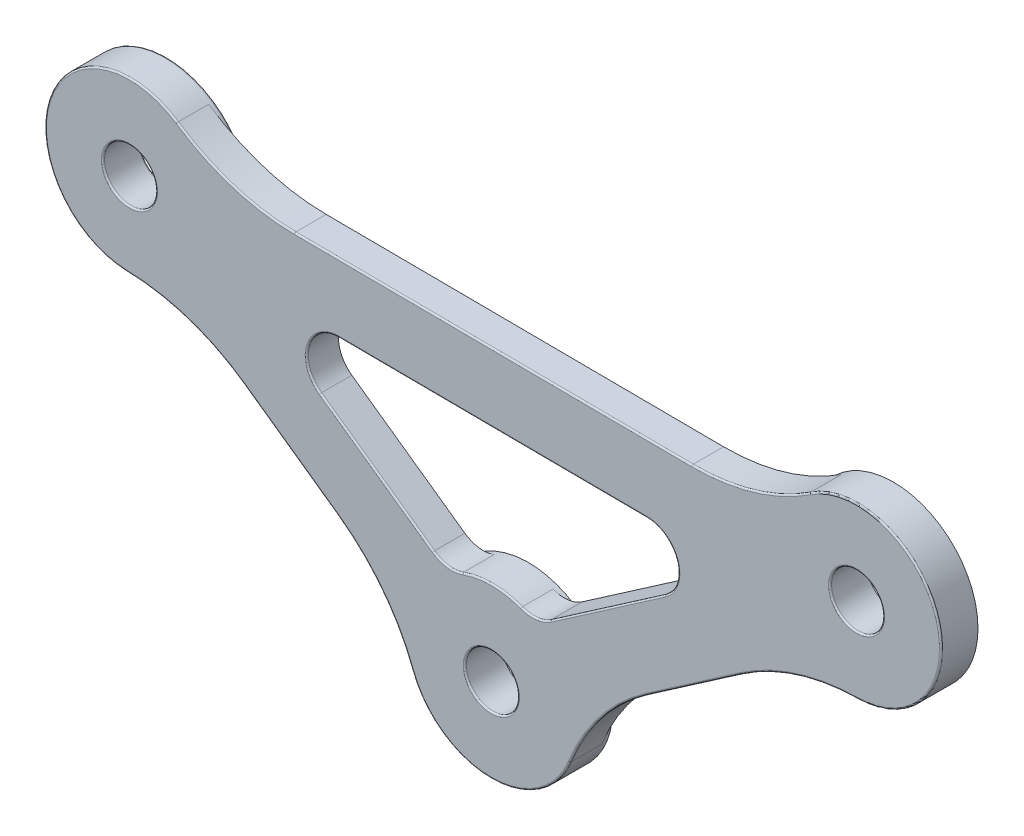
from build123d import *

# Parameters (mm, degrees)
SKETCH_1_R        = 8
SKETCH_1_R_2      = 2.5
EXTRUDE_1_DEPTH   = 3.5
EXTRUDE_1_2_DEPTH = 3.5
EXTRUDE_1_3_DEPTH = 3.5
EXTRUDE_1_4_DEPTH = 3
FILLET_1_R        = 3
FILLET_2_R        = 20
FILLET_3_R        = 0.15


with BuildPart() as part:
    # 草图1 → Extrude 1 (new body)
    with BuildSketch(Plane.XY):
        with Locations((-101.472478495, 222.230200701)):
            Circle(SKETCH_1_R)
        with Locations((-101.472478495, 222.230200701)):
            Circle(SKETCH_1_R_2, mode=Mode.SUBTRACT)
    extrude(amount=-EXTRUDE_1_DEPTH)



with BuildPart() as body_2:
    # 草图1 → Extrude 1 2 (new body)
    with BuildSketch(Plane.XY):
        with Locations((-32.665157049, 221.783455762)):
            Circle(SKETCH_1_R)
        with Locations((-32.665157049, 221.783455762)):
            Circle(SKETCH_1_R_2, mode=Mode.SUBTRACT)
    extrude(amount=-EXTRUDE_1_2_DEPTH)


with BuildPart() as body_3:
    # 草图1 → Extrude 1 3 (new body)
    with BuildSketch(Plane.XY):
        with Locations((-67.225224859, 197.917125651)):
            Circle(SKETCH_1_R)
        with Locations((-67.225224859, 197.917125651)):
            Circle(SKETCH_1_R_2, mode=Mode.SUBTRACT)
    extrude(amount=-EXTRUDE_1_3_DEPTH)


with BuildPart() as part_1:
    add(part.part)

    add(body_2.part)  # Extrude 1 4 merges body 2

    add(body_3.part)  # Extrude 1 4 merges body 3
    # 草图2 → Extrude 1 4 (add)
    with BuildSketch(Plane.XY):
        Polygon((-94.589918585, 218.935445838), (-39.589918585, 218.578347624), (-39.547716959, 225.078210624), (-94.547716959, 225.435308839), align=None)
        Polygon((-39.449108947, 221.048270993), (-64.134871668, 204.000892343), (-60.441272961, 198.65231042), (-35.755510239, 215.69968907), align=None)
        Polygon((-98.461382592, 216.106819162), (-73.999058567, 198.740336984), (-70.236320761, 204.040507189), (-94.698644787, 221.406989368), align=None)
    extrude(amount=-EXTRUDE_1_4_DEPTH)

    # 圆角1
    fillet_1_edges = [part_1.edges().sort_by_distance(p)[0] for p in [
        (-42.993723716, 218.600447492, -1.5),
        (-63.0568479, 204.745348958, -1.5),
        (-71.304586993, 204.798899011, -1.5),
        (-91.186113454, 218.91334597, -1.5),
    ]]
    fillet(fillet_1_edges, radius=FILLET_1_R)

    # 圆角2
    # the kernel refuses this fillet: 20 mm, written as the material it adds along each edge
    with BuildSketch(Plane(origin=(-94.141435997, 225.43267098, -3), x_dir=(-0.638505436471582, 0.7696173124327664, 0), z_dir=(0, 0, 1)), Plane(origin=(-36.833534007, 214.955232455, -3), x_dir=(0.9644673889945874, -0.26420192195736086, 0), z_dir=(0, 0, 1))) as fillet_2_piece_1:
        with BuildLine():
            CenterArc((9.973052641, -19.217229771), FILLET_2_R, 106.082980193, 33.864557297)
            Line((-5.336058514, -6.347454495), (0, 0))
            ThreePointArc((0, 0), (2.21623392, -0.313108092), (4.43246784, 0))
        make_face()
    extrude(amount=3)
    with BuildSketch(Plane(origin=(-39.95399792, 225.080848483, -3), x_dir=(-0.9999789231234605, 0.00649255795851874, 0), z_dir=(0, 0, 1)), Plane(origin=(-59.363249193, 199.396767035, -3), x_dir=(0.8228587573791318, 0.5682459550269326, 0), z_dir=(0, 0, 1)), Plane(origin=(-97.393116361, 215.348427341, -3), x_dir=(0.8154108008658386, -0.5788827392756946, 0), z_dir=(0, 0, 1))) as fillet_2_piece_2:
        with BuildLine():
            CenterArc((8.292388018, -20), FILLET_2_R, 90, 33.864557297)
            ThreePointArc((-2.852243251, -3.392857143), (-1.186451297, -1.89791011), (0, 0))
            Line((0, 0), (8.292388018, 0))
        make_face()
    extrude(amount=3)
    with BuildSketch(Plane(origin=(-75.067324798, 199.498728805, -3), x_dir=(-0.8154108008658375, 0.578882739275696, 0), z_dir=(0, 0, 1))) as fillet_2_piece_3:
        with BuildLine():
            CenterArc((8.292388018, 20), FILLET_2_R, 236.135442703, 33.864557297)
            ThreePointArc((-2.852243251, 3.392857143), (-1.186451297, 1.89791011), (0, 0))
            Line((0, 0), (8.292388018, 0))
        make_face()
    extrude(amount=3)

    # 圆角3
    fillet_3_edges = [part_1.edges().sort_by_distance(p)[0] for p in [
        (-67.089918585, 218.756896731, 0),
        (-78.076277889, 209.60631016, 0),
        (-56.223304427, 209.464425473, 0),
        (-67.173284395, 205.916957036, 0),
        (-84.546240762, 216.772308484, 0),
        (-49.660837657, 216.545808209, 0),
        (-62.965821684, 205.225696331, 0),
        (-71.3893683, 205.280387848, 0),
        (-67.047716959, 225.256759732, 0),
        (-28.878142084, 228.830335757, 0),
        (-109.086434491, 224.685332894, 0),
        (-86.23022058, 207.423578073, 0),
        (-67.277165322, 189.917294266, 0),
        (-48.0983916, 207.175999745, 0),
        (-42.415881112, 225.963857819, 0),
        (-91.668294621, 226.283638708, 0),
        (-95.882933059, 213.21303025, 0),
        (-77.581298649, 200.220192469, 0),
        (-56.840119194, 200.085526321, 0),
        (-38.371317785, 212.839624884, 0),
        (-35.165157049, 221.783455762, 0),
        (-109.472478495, 222.230200701, -3.5),
        (-103.972478495, 222.230200701, -3.5),
        (-103.972478495, 222.230200701, 0),
        (-69.725224859, 197.917125651, 0),
    ]]
    fillet(fillet_3_edges, radius=FILLET_3_R)


solid = part_1.part
